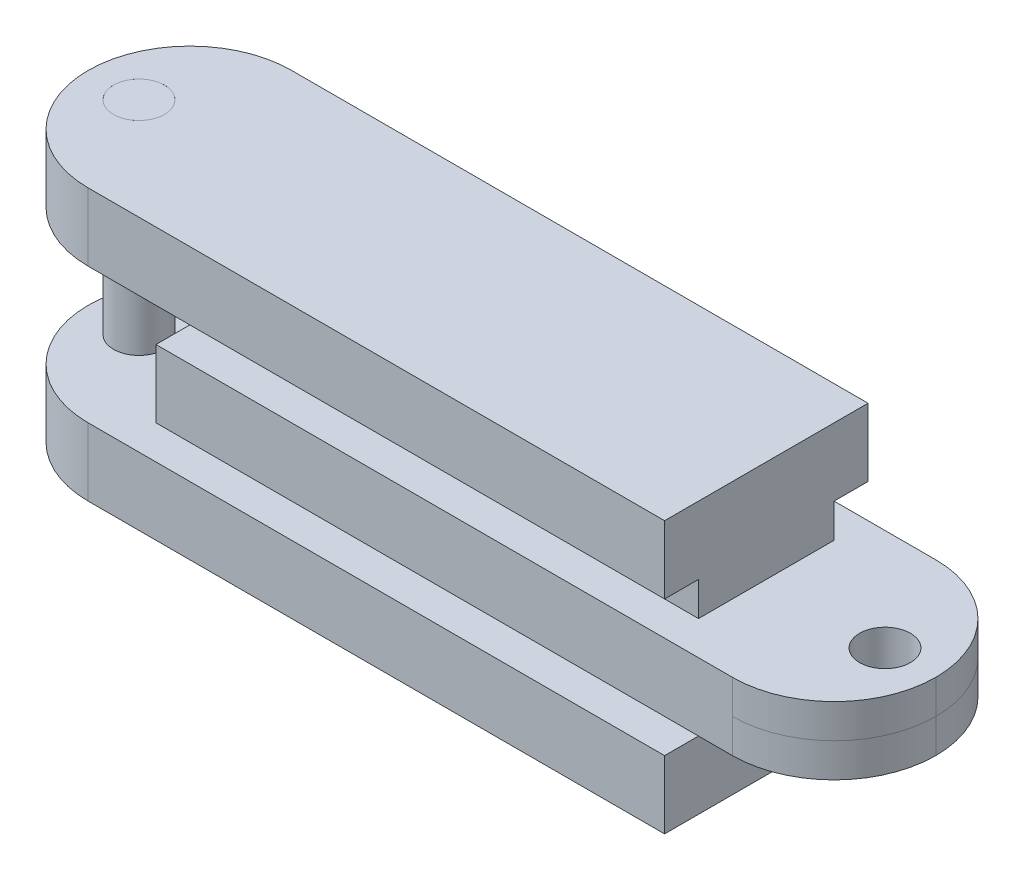
from build123d import *

# Parameters (mm, degrees)
BOSS_EXTRUDE1_DEPTH      = 30
SKETCH2_R                = 7.5
CUT_EXTRUDE1_DEPTH       = 159.113883008
FILLET6_R                = 30
FILLET7_R                = 30
SKETCH3_R                = 7.5
CUT_EXTRUDE2_DEPTH       = 155.272486205
FILLET8_R                = 30
FILLET9_R                = 30
FILLET6_OF_MIRROR1_R     = 30
FILLET7_OF_MIRROR1_R     = 30
FILLET8_OF_MIRROR1_R     = 30
FILLET9_OF_MIRROR1_R     = 30
SKETCH16_W               = 150
SKETCH16_H               = 10
CUT_EXTRUDE11_DEPTH      = 10
SKETCH17_W               = 150
SKETCH17_H               = 10
CUT_EXTRUDE12_DEPTH      = 10
SKETCH18_W               = 150
SKETCH18_H               = 10
CUT_EXTRUDE13_DEPTH      = 10
SKETCH19_W               = 150
SKETCH19_H               = 10
CUT_EXTRUDE14_DEPTH      = 10
BOSS_EXTRUDE2_DEPTH      = 60
BOSS_EXTRUDE2_DEPTH_BACK = 20
SKETCH21_R               = 7.5


with BuildPart() as part:
    # Sketch1 → Boss-Extrude1 (new, symmetric)
    with BuildSketch(Plane.XY):
        Polygon((-100, 0), (-100, 20), (-50, 20), (-50, 40), (150, 40), (150, 30), (100, 30), (100, 0), align=None)
    boss_extrude1 = extrude(amount=BOSS_EXTRUDE1_DEPTH, both=True)

    # Sketch2 → Cut-Extrude1 (cut, symmetric)
    with BuildSketch(Plane(origin=(0, 40, 0), x_dir=(1, 0, 0), z_dir=(0, 1, 0))):
        with Locations(Location((135, 0, 0), (0, 0, 180))):
            Circle(SKETCH2_R)
    cut_extrude1 = extrude(amount=CUT_EXTRUDE1_DEPTH, both=True, mode=Mode.SUBTRACT)

    # Fillet6
    fillet6_edges = [part.edges().sort_by_distance(p)[0] for p in [
        (150, 35, 30),
    ]]
    fillet(fillet6_edges, radius=FILLET6_R)

    # Fillet7
    fillet7_edges = [part.edges().sort_by_distance(p)[0] for p in [
        (150, 35, -30),
    ]]
    fillet(fillet7_edges, radius=FILLET7_R - 0.0001)  # a hair under: the kernel refuses the full size

    # Sketch3 → Cut-Extrude2 (cut, symmetric)
    with BuildSketch(Plane(origin=(0, 20, 0), x_dir=(1, 0, 0), z_dir=(0, 1, 0))):
        with Locations(Location((-85, 0, 0), (0, 0, 270))):
            Circle(SKETCH3_R)
    cut_extrude2 = extrude(amount=CUT_EXTRUDE2_DEPTH, both=True, mode=Mode.SUBTRACT)

    # Fillet8
    fillet8_edges = [part.edges().sort_by_distance(p)[0] for p in [
        (-100, 10, -30),
    ]]
    fillet(fillet8_edges, radius=FILLET8_R)

    # Fillet9
    fillet9_edges = [part.edges().sort_by_distance(p)[0] for p in [
        (-100, 10, 30),
    ]]
    fillet(fillet9_edges, radius=FILLET9_R - 0.0001)  # a hair under: the kernel refuses the full size

    # Mirror1: Boss-Extrude1, Cut-Extrude1, Cut-Extrude2 across plane
    add(boss_extrude1.mirror(Plane(origin=(-50, 40, -30), x_dir=(0, 0, 1), z_dir=(0, 1, 0))))
    add(cut_extrude1.mirror(Plane(origin=(-50, 40, -30), x_dir=(0, 0, 1), z_dir=(0, 1, 0))), mode=Mode.SUBTRACT)
    add(cut_extrude2.mirror(Plane(origin=(-50, 40, -30), x_dir=(0, 0, 1), z_dir=(0, 1, 0))), mode=Mode.SUBTRACT)

    # Fillet6 of Mirror1
    fillet6_of_mirror1_edges = [part.edges().sort_by_distance(p)[0] for p in [
        (150, 45, 30),
    ]]
    fillet(fillet6_of_mirror1_edges, radius=FILLET6_OF_MIRROR1_R)

    # Fillet7 of Mirror1
    fillet7_of_mirror1_edges = [part.edges().sort_by_distance(p)[0] for p in [
        (150, 45, -30),
    ]]
    fillet(fillet7_of_mirror1_edges, radius=FILLET7_OF_MIRROR1_R - 0.0001)  # a hair under: the kernel refuses the full size

    # Fillet8 of Mirror1
    fillet8_of_mirror1_edges = [part.edges().sort_by_distance(p)[0] for p in [
        (-100, 70, -30),
    ]]
    fillet(fillet8_of_mirror1_edges, radius=FILLET8_OF_MIRROR1_R)

    # Fillet9 of Mirror1
    fillet9_of_mirror1_edges = [part.edges().sort_by_distance(p)[0] for p in [
        (-100, 70, 30),
    ]]
    fillet(fillet9_of_mirror1_edges, radius=FILLET9_OF_MIRROR1_R - 0.0001)  # a hair under: the kernel refuses the full size

    # Sketch16 → Cut-Extrude11 (cut)
    with BuildSketch(Plane(origin=(0, 0, -30), x_dir=(-1, 0, 0), z_dir=(0, 0, -1))):
        with Locations((-25, 25)):
            Rectangle(SKETCH16_W, SKETCH16_H)
    extrude(amount=-CUT_EXTRUDE11_DEPTH, mode=Mode.SUBTRACT)

    # Sketch17 → Cut-Extrude12 (cut)
    with BuildSketch(Plane(origin=(0, 0, -30), x_dir=(-1, 0, 0), z_dir=(0, 0, -1))):
        with Locations((-25, 55)):
            Rectangle(SKETCH17_W, SKETCH17_H)
    extrude(amount=-CUT_EXTRUDE12_DEPTH, mode=Mode.SUBTRACT)

    # Sketch18 → Cut-Extrude13 (cut)
    with BuildSketch(Plane.XY.offset(30)):
        with Locations((25, 55)):
            Rectangle(SKETCH18_W, SKETCH18_H)
    extrude(amount=-CUT_EXTRUDE13_DEPTH, mode=Mode.SUBTRACT)

    # Sketch19 → Cut-Extrude14 (cut)
    with BuildSketch(Plane.XY.offset(30)):
        with Locations((25, 25)):
            Rectangle(SKETCH19_W, SKETCH19_H)
    extrude(amount=-CUT_EXTRUDE14_DEPTH, mode=Mode.SUBTRACT)


with BuildPart() as body_2:
    # Sketch21 → Boss-Extrude2 (new, two sides: drawn at the far end of the back side and taken through both)
    with BuildSketch(Plane(origin=(0, 20, 0), x_dir=(1, 0, 0), z_dir=(0, 1, 0)).offset(-BOSS_EXTRUDE2_DEPTH_BACK)):
        with Locations(Location((-85, 0, 0), (0, 0, 180))):
            Circle(SKETCH21_R)
    extrude(amount=BOSS_EXTRUDE2_DEPTH + BOSS_EXTRUDE2_DEPTH_BACK)


solid = Compound([part.part, body_2.part])
